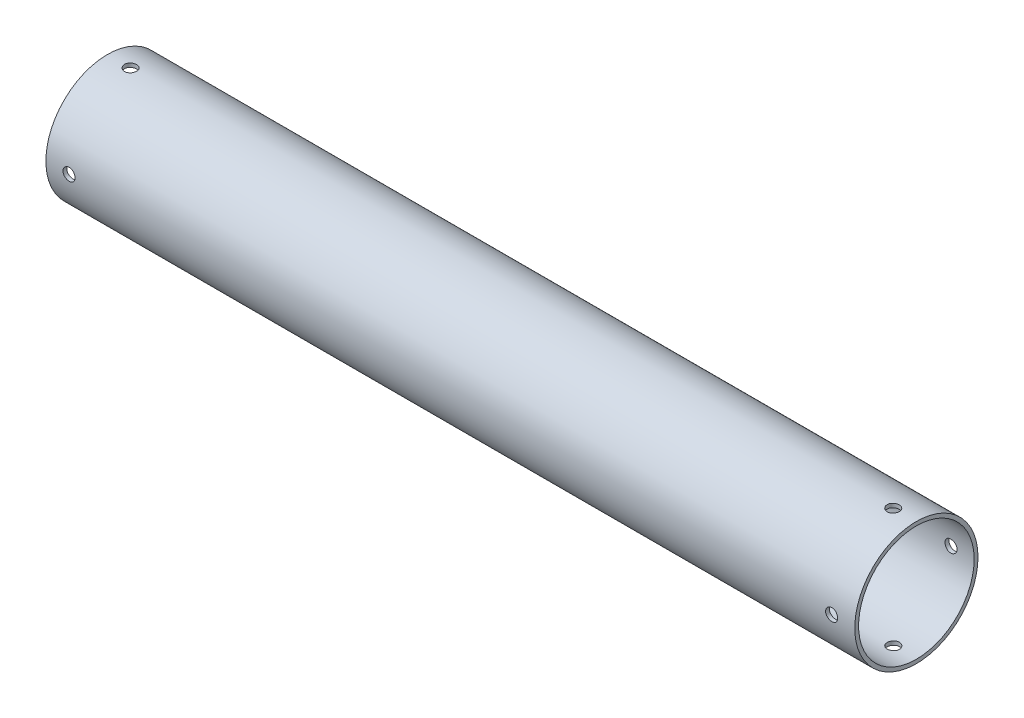
from build123d import *

# Parameters (mm, degrees)
SKETCH1_R               = 25.4
SKETCH1_R_2             = 23.8125
EXTRUDE_THIN1_DEPTH     = 166.6875
CUT_EXTRUDE1_DEPTH      = 171.514054131
CUT_EXTRUDE1_DEPTH_BACK = 171.514054131
SKETCH3_R               = 2.4892
CUT_EXTRUDE2_DEPTH      = 171.514054259
CUT_EXTRUDE2_DEPTH_BACK = 171.514054259
SKETCH4_R               = 2.4892


with BuildPart() as part:
    # Sketch1 → Extrude-Thin1 (new, symmetric)
    with BuildSketch(Plane(origin=(0, 0, 0), x_dir=(0, 0, -1), z_dir=(1, 0, 0))):
        Circle(SKETCH1_R)
        Circle(SKETCH1_R_2, mode=Mode.SUBTRACT)
    extrude(amount=EXTRUDE_THIN1_DEPTH, both=True)

    # Sketch3 → Cut-Extrude1 (cut, two sides: drawn at the far end of the back side and taken through both)
    with BuildSketch(Plane.XY.offset(-CUT_EXTRUDE1_DEPTH_BACK)):
        with Locations((-157.1625, 0)):
            Circle(SKETCH3_R)
        with Locations((157.1625, 0)):
            Circle(SKETCH3_R)
    extrude(amount=CUT_EXTRUDE1_DEPTH + CUT_EXTRUDE1_DEPTH_BACK, mode=Mode.SUBTRACT)

    # Sketch4 → Cut-Extrude2 (cut, two sides: drawn at the far end of the back side and taken through both)
    with BuildSketch(Plane(origin=(0, 0, 0), x_dir=(1, 0, 0), z_dir=(0, 1, 0)).offset(-CUT_EXTRUDE2_DEPTH_BACK)):
        with Locations((-157.1625, 0)):
            Circle(SKETCH4_R)
        with Locations((157.1625, 0)):
            Circle(SKETCH4_R)
    extrude(amount=CUT_EXTRUDE2_DEPTH + CUT_EXTRUDE2_DEPTH_BACK, mode=Mode.SUBTRACT)


solid = part.part
